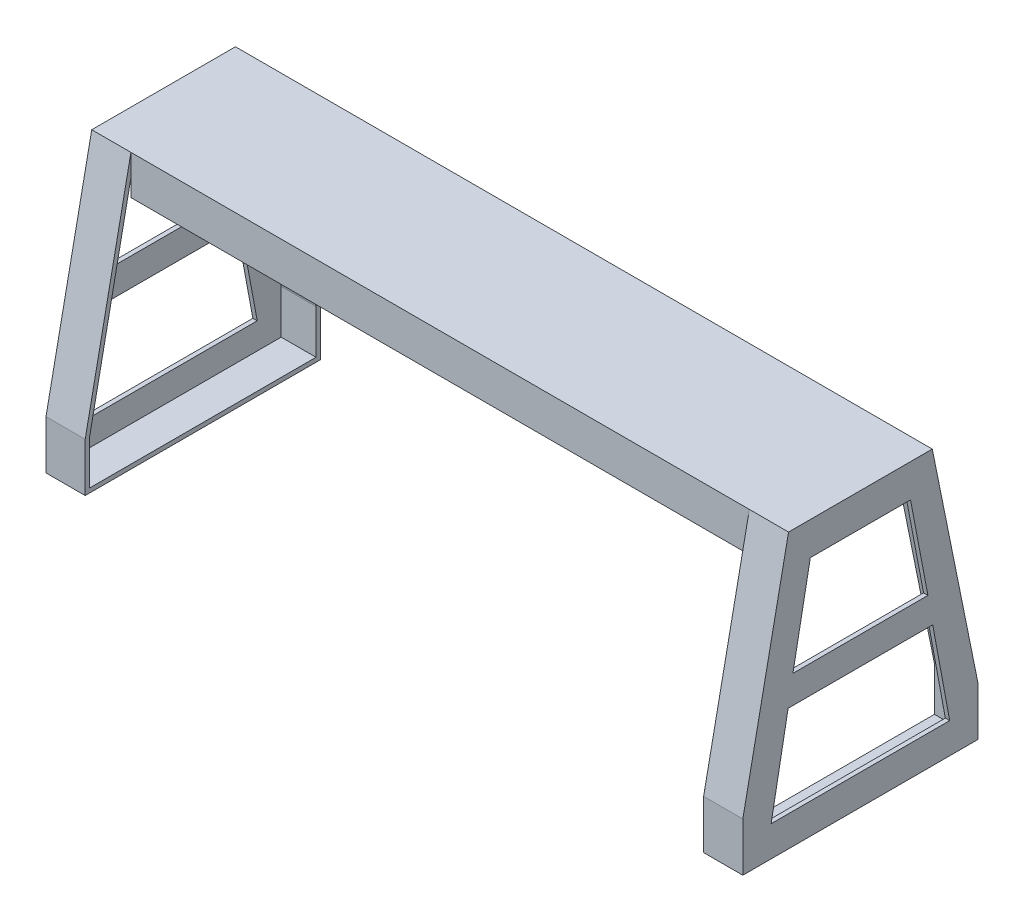
from build123d import *

# Parameters (mm, degrees)
CROQUIS1_W              = 800
CROQUIS1_H              = 270
SALIENTE_EXTRUIR1_DEPTH = 315
CROQUIS2_W              = 710
CROQUIS2_H              = 52.5
CORTAR_EXTRUIR2_DEPTH   = 315
CORTAR_EXTRUIR6_DEPTH   = 800
CROQUIS8_W              = 710
CROQUIS8_H              = 270
CORTAR_EXTRUIR7_DEPTH   = 200
VACIADO5_START          = -395
VACIADO5_OUTLINE_W      = 40
VACIADO5_OUTLINE_H      = 155
VACIADO5_DEPTH          = 790
VACIADO5_2_DEPTH        = 40
VACIADO5_START_2        = 355
VACIADO5_3_DEPTH        = 40
CORTAR_EXTRUIR8_DEPTH   = 800


# Read off the part's stored shape, not the designer's step: Vaciado5
with BuildPart() as part:
    # Croquis1 → Saliente-Extruir1 (new body)
    with BuildSketch(Plane(origin=(0, 0, 0), x_dir=(1, 0, 0), z_dir=(0, 1, 0))):
        Rectangle(CROQUIS1_W, CROQUIS1_H)
    extrude(amount=SALIENTE_EXTRUIR1_DEPTH)

    # Croquis2 → Cortar-Extruir2 (cut)
    with BuildSketch(Plane(origin=(0, 315, 0), x_dir=(1, 0, 0), z_dir=(0, 1, 0))):
        with Locations((0, 108.75)):
            Rectangle(CROQUIS2_W, CROQUIS2_H)
        with Locations((0, -108.75)):
            Rectangle(CROQUIS2_W, CROQUIS2_H)
    extrude(amount=-CORTAR_EXTRUIR2_DEPTH, mode=Mode.SUBTRACT)

    # Croquis4 → Cortar-Extruir6 (cut)
    with BuildSketch(Plane(origin=(400, 0, 0), x_dir=(0, 0, -1), z_dir=(1, 0, 0))):
        Polygon((135, 315), (82.5, 315), (135, 56), align=None)
        Polygon((-135, 315), (-82.5, 315), (-135, 56), align=None)
    extrude(amount=-CORTAR_EXTRUIR6_DEPTH, mode=Mode.SUBTRACT)

    # Croquis8 → Cortar-Extruir7 (cut)
    with BuildSketch(Plane.XY.offset(82.5)):
        with Locations((0, 135)):
            Rectangle(CROQUIS8_W, CROQUIS8_H)
    extrude(amount=-CORTAR_EXTRUIR7_DEPTH, mode=Mode.SUBTRACT)

    # Vaciado5 outline → Vaciado5 (cut)
    with BuildSketch(Plane.YZ.offset(VACIADO5_START)):
        with Locations((290, 0)):
            Rectangle(VACIADO5_OUTLINE_W, VACIADO5_OUTLINE_H)
    extrude(amount=VACIADO5_DEPTH, mode=Mode.SUBTRACT)

    # Vaciado5 2 outline → Vaciado5 2 (cut)
    with BuildSketch(Plane.YZ.offset(VACIADO5_START)):
        Polygon((5, 130), (5, -130), (55.498344425, -130), (310, -78.411826573), (310, -77.5), (270, -77.5), (270, 77.5), (310, 77.5), (310, 78.411826573), (55.498344425, 130), align=None)
    extrude(amount=VACIADO5_2_DEPTH, mode=Mode.SUBTRACT)

    # Vaciado5 3 outline → Vaciado5 3 (cut)
    with BuildSketch(Plane.YZ.offset(VACIADO5_START_2)):
        Polygon((5, 130), (5, -130), (55.498344425, -130), (310, -78.411826573), (310, -77.5), (270, -77.5), (270, 77.5), (310, 77.5), (310, 78.411826573), (55.498344425, 130), align=None)
    extrude(amount=VACIADO5_3_DEPTH, mode=Mode.SUBTRACT)

    # Croquis9 → Cortar-Extruir8 (cut)
    with BuildSketch(Plane(origin=(400, 0, 0), x_dir=(0, 0, -1), z_dir=(1, 0, 0))):
        Polygon((-102.5, 35), (102.5, 35), (83, 140), (-83, 140), align=None)
        Polygon((-77.5, 172), (77.5, 172), (57.5, 277), (-57.5, 277), align=None)
    extrude(amount=-CORTAR_EXTRUIR8_DEPTH, mode=Mode.SUBTRACT)


solid = part.part
